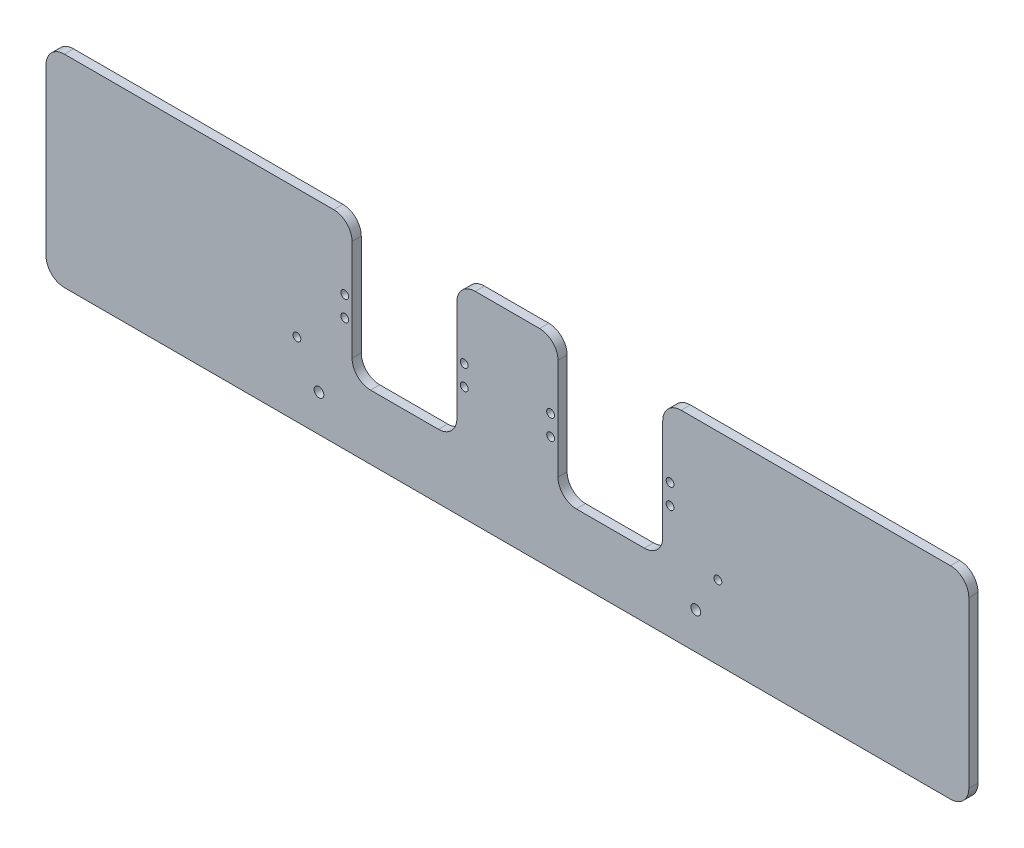
from build123d import *

# Parameters (mm, degrees)
BOSS_EXTRUDE1_DEPTH = 5
SKETCH3_R           = 2.125
CUT_EXTRUDE1_DEPTH  = 10
FILLET1_R           = 10
SKETCH4_R           = 2.65
CUT_EXTRUDE2_DEPTH  = 10
SKETCH5_R           = 2.125
CUT_EXTRUDE3_DEPTH  = 10
FILLET2_R           = 10


with BuildPart() as part:
    # Sketch1 → Boss-Extrude1 (new body)
    with BuildSketch(Plane.XY):
        Polygon((0, 0), (0, 110), (166.5, 110), (166.5, 35), (223.5, 35), (223.5, 110), (278.5, 110), (278.5, 35), (335.5, 35), (335.5, 110), (502, 110), (502, 0), align=None)
    extrude(amount=BOSS_EXTRUDE1_DEPTH)

    # Sketch3 → Cut-Extrude1 (cut)
    with BuildSketch(Plane.XY.offset(5)):
        with Locations((162.5, 73)):
            Circle(SKETCH3_R)
        with Locations((162.5, 62)):
            Circle(SKETCH3_R)
        with Locations((227.5, 62)):
            Circle(SKETCH3_R)
        with Locations((227.5, 73)):
            Circle(SKETCH3_R)
        with Locations((274.5, 73)):
            Circle(SKETCH3_R)
        with Locations((274.5, 62)):
            Circle(SKETCH3_R)
        with Locations((339.5, 62)):
            Circle(SKETCH3_R)
        with Locations((339.5, 73)):
            Circle(SKETCH3_R)
    extrude(amount=-CUT_EXTRUDE1_DEPTH, mode=Mode.SUBTRACT)

    # Fillet1
    fillet1_edges = [part.edges().sort_by_distance(p)[0] for p in [
        (502, 0, 2.5),
        (502, 110, 2.5),
        (0, 0, 2.5),
        (0, 110, 2.5),
    ]]
    fillet(fillet1_edges, radius=FILLET1_R)

    # Sketch4 → Cut-Extrude2 (cut)
    with BuildSketch(Plane.XY.offset(5)):
        with Locations((148.5, 20)):
            Circle(SKETCH4_R)
        with Locations((353.5, 20)):
            Circle(SKETCH4_R)
    extrude(amount=-CUT_EXTRUDE2_DEPTH, mode=Mode.SUBTRACT)

    # Sketch5 → Cut-Extrude3 (cut)
    with BuildSketch(Plane.XY.offset(5)):
        with Locations((365.5, 40)):
            Circle(SKETCH5_R)
        with Locations((136.5, 40)):
            Circle(SKETCH5_R)
    extrude(amount=-CUT_EXTRUDE3_DEPTH, mode=Mode.SUBTRACT)

    # Fillet2
    fillet2_edges = [part.edges().sort_by_distance(p)[0] for p in [
        (335.5, 35, 2.5),
        (335.5, 110, 2.5),
        (278.5, 110, 2.5),
        (278.5, 35, 2.5),
        (223.5, 35, 2.5),
        (223.5, 110, 2.5),
        (166.5, 35, 2.5),
        (166.5, 110, 2.5),
    ]]
    fillet(fillet2_edges, radius=FILLET2_R)


solid = part.part
